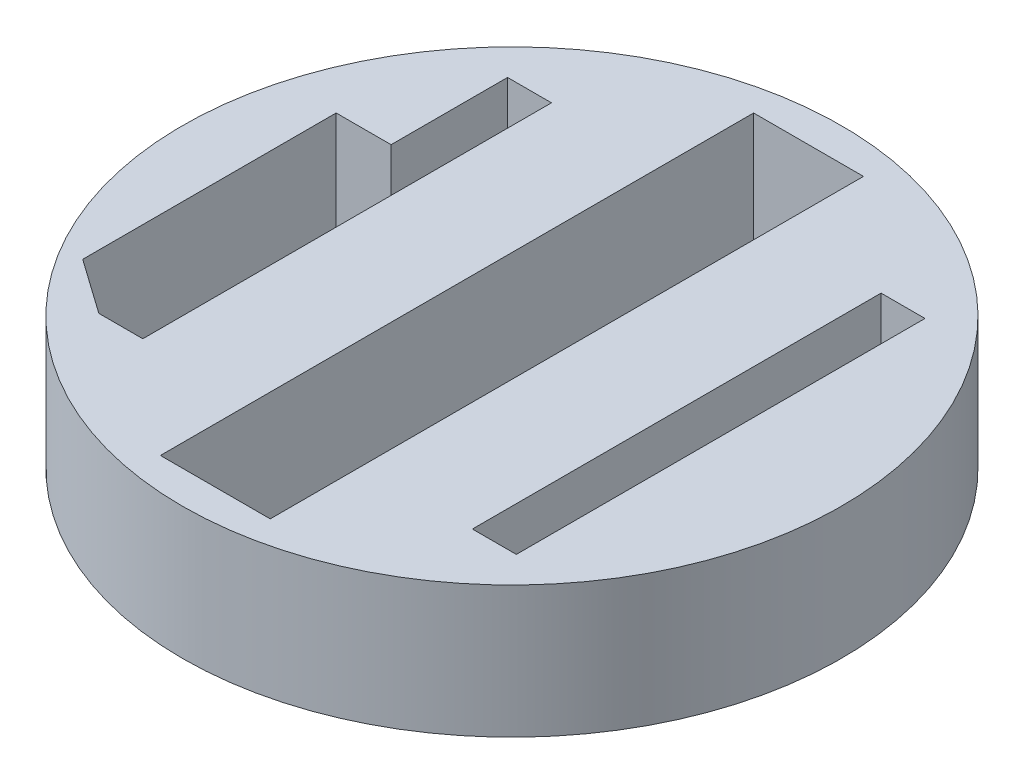
from build123d import *

# Parameters (mm, degrees)
SKETCH_3_R          = 15
EXTRUDE_2_DEPTH     = 6
SKETCH_8_W          = 2
SKETCH_8_H          = 18.6
CUT_EXTRUDE_1_DEPTH = 23.045407685
SKETCH_9_W          = 5
SKETCH_9_H          = 27
CUT_EXTRUDE_2_DEPTH = 23.045407685


with BuildPart() as part:
    # Эскиз3 → Бобышка-Вытянуть2 (new body)
    with BuildSketch(Plane(origin=(0, 0, 0), x_dir=(1, 0, 0), z_dir=(0, 1, 0))):
        Circle(SKETCH_3_R)
    extrude(amount=EXTRUDE_2_DEPTH)

    # Эскиз8 → Вырез-Вытянуть1 (cut, through all)
    with BuildSketch(Plane(origin=(0, 6, 0), x_dir=(1, 0, 0), z_dir=(0, 1, 0))):
        Polygon((-12, -4), (-12, -7.536943183), (-9.5, -9.3), (-7.5, -9.3), (-7.5, 9.3), (-9.5, 9.3), (-9.5, 4), (-12, 4), align=None)
        with Locations((8.5, 0)):
            Rectangle(SKETCH_8_W, SKETCH_8_H)
    extrude(amount=-CUT_EXTRUDE_1_DEPTH, mode=Mode.SUBTRACT)

    # Эскиз9 → Вырез-Вытянуть2 (cut, through all)
    with BuildSketch(Plane(origin=(0, 6, 0), x_dir=(1, 0, 0), z_dir=(0, 1, 0))):
        Rectangle(SKETCH_9_W, SKETCH_9_H)
    extrude(amount=-CUT_EXTRUDE_2_DEPTH, mode=Mode.SUBTRACT)


solid = part.part
